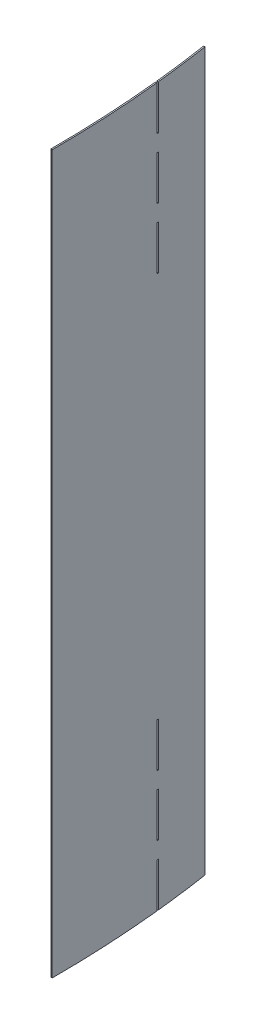
from build123d import *

# Parameters (mm, degrees)
BASE_FLANGE1_DEPTH        = 130
UNFOLD1_DEPTH             = 130
UNFOLD1_2_DEPTH           = 130
SKETCH6_W                 = 0.3
SKETCH6_H                 = 8
CUT_EXTRUDE1_DEPTH        = 235.985371885
LPATTERN1_COUNT           = 3
LPATTERN1_PITCH           = 11
LPATTERN2_COUNT           = 3
LPATTERN2_PITCH           = 100
LPATTERN2_COPY_1_SKETCH_W = 0.3
LPATTERN2_COPY_1_SKETCH_H = 8
LPATTERN2_COPY_1_DEPTH    = 235.985371885
LPATTERN2_COPY_2_SKETCH_W = 0.3
LPATTERN2_COPY_2_SKETCH_H = 8
LPATTERN2_COPY_2_DEPTH    = 235.985371885
LPATTERN2_COPY_3_SKETCH_W = 0.3
LPATTERN2_COPY_3_SKETCH_H = 8
LPATTERN2_COPY_3_DEPTH    = 235.985371885
LPATTERN2_COPY_4_SKETCH_W = 0.3
LPATTERN2_COPY_4_SKETCH_H = 8
LPATTERN2_COPY_4_DEPTH    = 235.985371885
FOLD1_DEPTH               = 130
FOLD1_2_DEPTH             = 130
FOLD1_START               = 30
FOLD1_3_DEPTH             = 70
FOLD1_START_2             = 8
FOLD1_4_DEPTH             = 3
FOLD1_START_3             = 19
FOLD1_5_DEPTH             = 3
FOLD1_START_4             = 108
FOLD1_6_DEPTH             = 3
FOLD1_START_5             = 119
FOLD1_7_DEPTH             = 3


# Read off the part's stored shape, not the designer's step: Unfold1, Fold1
# Sheet-metal steps are written as plain solids
with BuildPart() as part:
    # Sketch1 → Base-Flange1 (new body)
    with BuildSketch(Plane(origin=(0, 0, 0), x_dir=(1, 0, 0), z_dir=(0, 1, 0))):
        with BuildLine():
            ThreePointArc((195.5, 0), (194.920264754, 15.044613261), (193.184497308, 30))
            Line((193.184497308, 30), (193.431536307, 30.038363171))
            ThreePointArc((193.431536307, 30.038363171), (195.169523405, 15.063851897), (195.75, 0))
            Line((195.75, 0), (195.5, 0))
        make_face()
    extrude(amount=BASE_FLANGE1_DEPTH)

    # Unfold1 outline → Unfold1 (cut)
    with BuildSketch(Plane(origin=(0, 0, 0), x_dir=(1, 0, 0), z_dir=(0, 1, 0))):
        with BuildLine():
            Line((195.5, 0), (195.5, 9.890020227))
            ThreePointArc((195.5, 9.890020227), (194.726536236, 19.990962601), (193.431536307, 30.038363171))
            Line((193.431536307, 30.038363171), (193.184497308, 30))
            ThreePointArc((193.184497308, 30), (194.920264754, 15.044613261), (195.5, 0))
        make_face()
    extrude(amount=UNFOLD1_DEPTH, mode=Mode.SUBTRACT)

    # Unfold1 2 outline → Unfold1 2 (add)
    with BuildSketch(Plane(origin=(0, 0, 0), x_dir=(1, 0, 0), z_dir=(0, 1, 0))):
        with BuildLine():
            Line((195.75, 0), (195.75, 30.138261696))
            Line((195.75, 30.138261696), (195.5, 30.138261696))
            Line((195.5, 30.138261696), (195.5, 9.890020227))
            ThreePointArc((195.5, 9.890020227), (195.687490019, 4.946589737), (195.75, 0))
        make_face()
    extrude(amount=UNFOLD1_2_DEPTH)

    # Sketch6 → Cut-Extrude1 (cut, symmetric)
    with BuildSketch(Plane(origin=(195.75, 0, -195.75), x_dir=(0, 0, 1), z_dir=(-1, 0, 0))):
        with Locations((175.6, 126)):
            Rectangle(SKETCH6_W, SKETCH6_H)
    cut_extrude1 = extrude(amount=CUT_EXTRUDE1_DEPTH, both=True, mode=Mode.SUBTRACT)

    # LPattern1: Cut-Extrude1 ×3
    with Locations(*[(0, -i * LPATTERN1_PITCH, 0) for i in range(1, LPATTERN1_COUNT)]):
        add(cut_extrude1, mode=Mode.SUBTRACT)

    # LPattern2: Cut-Extrude1 ×3
    with Locations(*[(0, -i * LPATTERN2_PITCH, 0) for i in range(1, LPATTERN2_COUNT)]):
        add(cut_extrude1, mode=Mode.SUBTRACT)

    # LPattern2 copy 1 sketch → LPattern2 copy 1 (cut, symmetric)
    with BuildSketch(Plane(origin=(195.75, -111, -195.75), x_dir=(0, 0, 1), z_dir=(-1, 0, 0))):
        with Locations((175.6, 126)):
            Rectangle(LPATTERN2_COPY_1_SKETCH_W, LPATTERN2_COPY_1_SKETCH_H)
    extrude(amount=LPATTERN2_COPY_1_DEPTH, both=True, mode=Mode.SUBTRACT)

    # LPattern2 copy 2 sketch → LPattern2 copy 2 (cut, symmetric)
    with BuildSketch(Plane(origin=(195.75, -211, -195.75), x_dir=(0, 0, 1), z_dir=(-1, 0, 0))):
        with Locations((175.6, 126)):
            Rectangle(LPATTERN2_COPY_2_SKETCH_W, LPATTERN2_COPY_2_SKETCH_H)
    extrude(amount=LPATTERN2_COPY_2_DEPTH, both=True, mode=Mode.SUBTRACT)

    # LPattern2 copy 3 sketch → LPattern2 copy 3 (cut, symmetric)
    with BuildSketch(Plane(origin=(195.75, -122, -195.75), x_dir=(0, 0, 1), z_dir=(-1, 0, 0))):
        with Locations((175.6, 126)):
            Rectangle(LPATTERN2_COPY_3_SKETCH_W, LPATTERN2_COPY_3_SKETCH_H)
    extrude(amount=LPATTERN2_COPY_3_DEPTH, both=True, mode=Mode.SUBTRACT)

    # LPattern2 copy 4 sketch → LPattern2 copy 4 (cut, symmetric)
    with BuildSketch(Plane(origin=(195.75, -222, -195.75), x_dir=(0, 0, 1), z_dir=(-1, 0, 0))):
        with Locations((175.6, 126)):
            Rectangle(LPATTERN2_COPY_4_SKETCH_W, LPATTERN2_COPY_4_SKETCH_H)
    extrude(amount=LPATTERN2_COPY_4_DEPTH, both=True, mode=Mode.SUBTRACT)

    # Fold1 outline → Fold1 (cut)
    with BuildSketch(Plane(origin=(0, 0, 0), x_dir=(1, 0, 0), z_dir=(0, 1, 0))):
        with BuildLine():
            ThreePointArc((195.5, 9.890020227), (195.687490019, 4.946589737), (195.75, 0))
            Line((195.75, 0), (195.75, 30.138261696))
            Line((195.75, 30.138261696), (195.5, 30.138261696))
            Line((195.5, 30.138261696), (195.5, 9.890020227))
        make_face()
    extrude(amount=FOLD1_DEPTH, mode=Mode.SUBTRACT)

    # Fold1 2 outline → Fold1 2 (add)
    with BuildSketch(Plane(origin=(0, 0, 0), x_dir=(1, 0, 0), z_dir=(0, 1, 0))):
        with BuildLine():
            Line((194.448352042, 20.2506392), (194.697007224, 20.276535158))
            ThreePointArc((194.697007224, 20.276535158), (194.12564204, 25.165404877), (193.431536307, 30.038363171))
            Line((193.431536307, 30.038363171), (193.184497308, 30))
            ThreePointArc((193.184497308, 30), (193.877716571, 25.133265152), (194.448352042, 20.2506392))
        make_face()
        with BuildLine():
            ThreePointArc((195.5, 9.890020227), (195.179122281, 14.938966685), (194.727873277, 19.977934553))
            Line((194.727873277, 19.977934553), (194.479178675, 19.952419949))
            ThreePointArc((194.479178675, 19.952419949), (195.244627879, 9.989258456), (195.5, 0))
            Line((195.5, 0), (195.5, 9.890020227))
        make_face()
    extrude(amount=FOLD1_2_DEPTH)

    # Fold1 3 outline → Fold1 3 (add)
    with BuildSketch(Plane(origin=(0, 0, 0), x_dir=(1, 0, 0), z_dir=(0, 1, 0)).offset(FOLD1_START)):
        with BuildLine():
            ThreePointArc((194.727873277, 19.977934553), (194.712497491, 20.127240772), (194.697007224, 20.276535158))
            Line((194.697007224, 20.276535158), (194.448352042, 20.2506392))
            ThreePointArc((194.448352042, 20.2506392), (194.463822525, 20.101535484), (194.479178675, 19.952419949))
            Line((194.479178675, 19.952419949), (194.727873277, 19.977934553))
        make_face()
    extrude(amount=FOLD1_3_DEPTH)

    # Fold1 4 outline → Fold1 4 (add)
    with BuildSketch(Plane(origin=(0, 0, 0), x_dir=(1, 0, 0), z_dir=(0, 1, 0)).offset(FOLD1_START_2)):
        with BuildLine():
            ThreePointArc((194.727873277, 19.977934553), (194.712497491, 20.127240772), (194.697007224, 20.276535158))
            Line((194.697007224, 20.276535158), (194.448352042, 20.2506392))
            ThreePointArc((194.448352042, 20.2506392), (194.463822525, 20.101535484), (194.479178675, 19.952419949))
            Line((194.479178675, 19.952419949), (194.727873277, 19.977934553))
        make_face()
    extrude(amount=FOLD1_4_DEPTH)

    # Fold1 5 outline → Fold1 5 (add)
    with BuildSketch(Plane(origin=(0, 0, 0), x_dir=(1, 0, 0), z_dir=(0, 1, 0)).offset(FOLD1_START_3)):
        with BuildLine():
            ThreePointArc((194.727873277, 19.977934553), (194.712497491, 20.127240772), (194.697007224, 20.276535158))
            Line((194.697007224, 20.276535158), (194.448352042, 20.2506392))
            ThreePointArc((194.448352042, 20.2506392), (194.463822525, 20.101535484), (194.479178675, 19.952419949))
            Line((194.479178675, 19.952419949), (194.727873277, 19.977934553))
        make_face()
    extrude(amount=FOLD1_5_DEPTH)

    # Fold1 6 outline → Fold1 6 (add)
    with BuildSketch(Plane(origin=(0, 0, 0), x_dir=(1, 0, 0), z_dir=(0, 1, 0)).offset(FOLD1_START_4)):
        with BuildLine():
            ThreePointArc((194.727873277, 19.977934553), (194.712497491, 20.127240772), (194.697007224, 20.276535158))
            Line((194.697007224, 20.276535158), (194.448352042, 20.2506392))
            ThreePointArc((194.448352042, 20.2506392), (194.463822525, 20.101535484), (194.479178675, 19.952419949))
            Line((194.479178675, 19.952419949), (194.727873277, 19.977934553))
        make_face()
    extrude(amount=FOLD1_6_DEPTH)

    # Fold1 7 outline → Fold1 7 (add)
    with BuildSketch(Plane(origin=(0, 0, 0), x_dir=(1, 0, 0), z_dir=(0, 1, 0)).offset(FOLD1_START_5)):
        with BuildLine():
            ThreePointArc((194.727873277, 19.977934553), (194.712497491, 20.127240772), (194.697007224, 20.276535158))
            Line((194.697007224, 20.276535158), (194.448352042, 20.2506392))
            ThreePointArc((194.448352042, 20.2506392), (194.463822525, 20.101535484), (194.479178675, 19.952419949))
            Line((194.479178675, 19.952419949), (194.727873277, 19.977934553))
        make_face()
    extrude(amount=FOLD1_7_DEPTH)


solid = part.part
